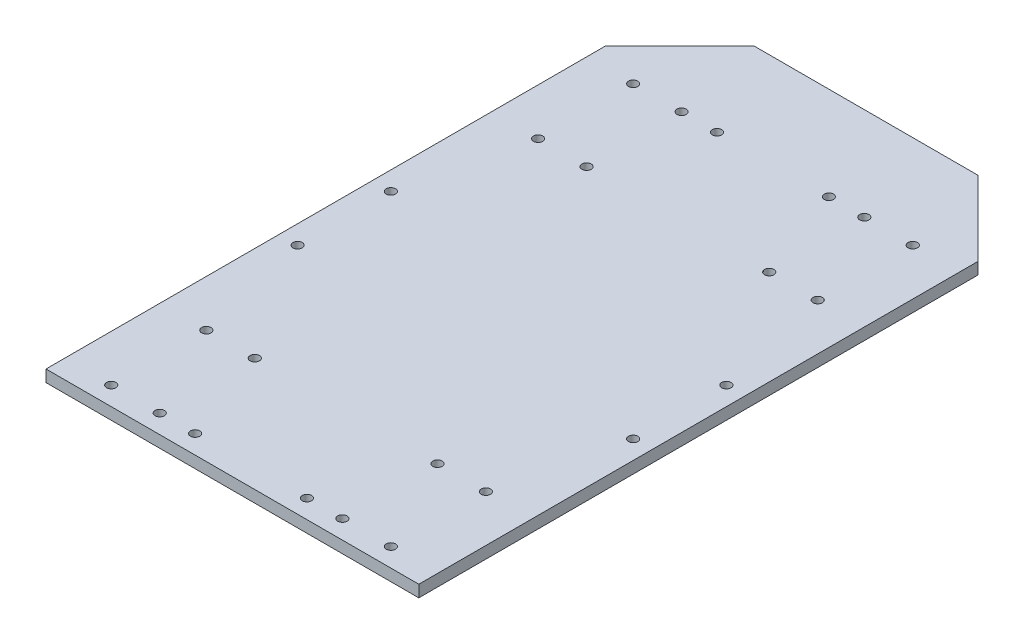
from build123d import *

# Parameters (mm, degrees)
SKETCH1_R           = 2.5
BOSS_EXTRUDE1_DEPTH = 6.35
SKETCH2_R           = 2.5
CUT_EXTRUDE1_DEPTH  = 10


with BuildPart() as part:
    # Sketch1 → Boss-Extrude1 (new body)
    with BuildSketch(Plane(origin=(0, 0, 0), x_dir=(1, 0, 0), z_dir=(0, 1, 0))):
        Polygon((-160, 340), (-200, 300), (-200, 0), (0, 0), (0, 300), (-40, 340), align=None)
        with Locations((-25, 290)):
            Circle(SKETCH1_R, mode=Mode.SUBTRACT)
        with Locations((-175, 10)):
            Circle(SKETCH1_R, mode=Mode.SUBTRACT)
        with Locations((-175, 61)):
            Circle(SKETCH1_R, mode=Mode.SUBTRACT)
        with Locations((-149, 10)):
            Circle(SKETCH1_R, mode=Mode.SUBTRACT)
        with Locations((-149, 61)):
            Circle(SKETCH1_R, mode=Mode.SUBTRACT)
        with Locations((-51, 10)):
            Circle(SKETCH1_R, mode=Mode.SUBTRACT)
        with Locations((-51, 61)):
            Circle(SKETCH1_R, mode=Mode.SUBTRACT)
        with Locations((-25, 10)):
            Circle(SKETCH1_R, mode=Mode.SUBTRACT)
        with Locations((-25, 61)):
            Circle(SKETCH1_R, mode=Mode.SUBTRACT)
        with Locations((-175, 239)):
            Circle(SKETCH1_R, mode=Mode.SUBTRACT)
        with Locations((-149, 239)):
            Circle(SKETCH1_R, mode=Mode.SUBTRACT)
        with Locations((-175, 290)):
            Circle(SKETCH1_R, mode=Mode.SUBTRACT)
        with Locations((-149, 290)):
            Circle(SKETCH1_R, mode=Mode.SUBTRACT)
        with Locations((-51, 239)):
            Circle(SKETCH1_R, mode=Mode.SUBTRACT)
        with Locations((-25, 239)):
            Circle(SKETCH1_R, mode=Mode.SUBTRACT)
        with Locations((-51, 290)):
            Circle(SKETCH1_R, mode=Mode.SUBTRACT)
    extrude(amount=BOSS_EXTRUDE1_DEPTH)

    # Sketch2 → Cut-Extrude1 (cut)
    with BuildSketch(Plane(origin=(0, 6.35, 0), x_dir=(1, 0, 0), z_dir=(0, 1, 0))):
        with Locations((-70, 10)):
            Circle(SKETCH2_R)
        with Locations((-10, 125)):
            Circle(SKETCH2_R)
        with Locations((-190, 125)):
            Circle(SKETCH2_R)
        with Locations((-130, 10)):
            Circle(SKETCH2_R)
        with Locations((-70, 290)):
            Circle(SKETCH2_R)
        with Locations((-10, 175)):
            Circle(SKETCH2_R)
        with Locations((-190, 175)):
            Circle(SKETCH2_R)
        with Locations((-130, 290)):
            Circle(SKETCH2_R)
    extrude(amount=-CUT_EXTRUDE1_DEPTH, mode=Mode.SUBTRACT)


solid = part.part
